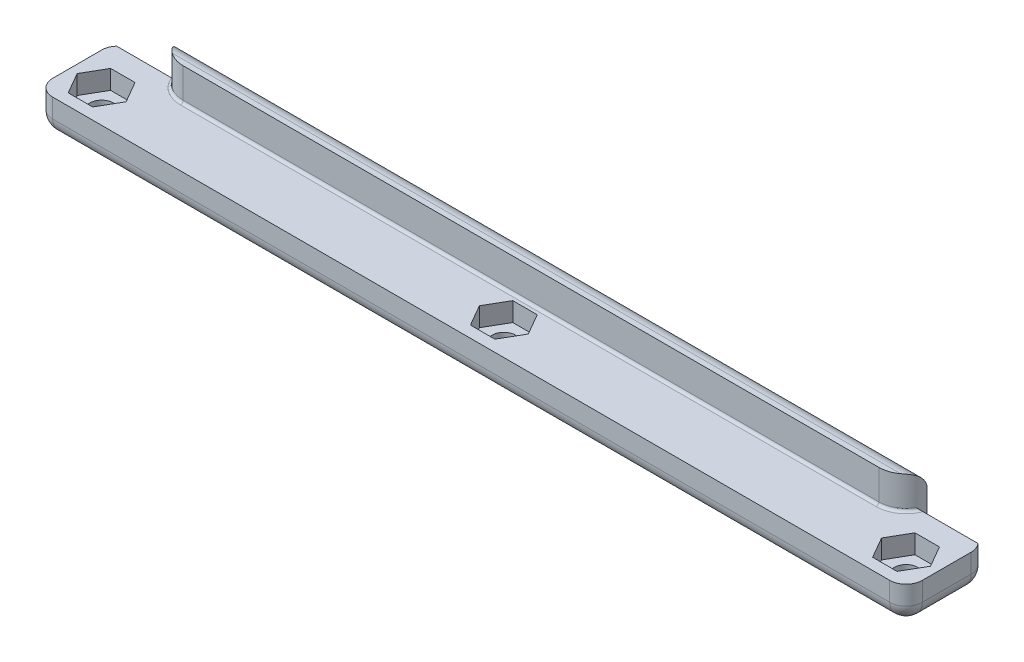
from build123d import *

# Parameters (mm, degrees)
SKETCH1_W                = 160
SKETCH1_H                = 12
BOSS_EXTRUDE1_DEPTH      = 3.5
SKETCH2_W                = 160
SKETCH2_H                = 12
SKETCH2_R                = 2.15
BOSS_EXTRUDE2_DEPTH      = 3
BOSS_EXTRUDE3_DEPTH      = 6
BOSS_EXTRUDE3_DEPTH_BACK = 6.5
CAVITY1_START            = 2.5
CAVITY1_DEPTH            = 7.5
CAVITY1_START_2          = -160
CAVITY1_2_DEPTH          = 160
FILLET2_R                = 3
FILLET3_R                = 3
FILLET4_R                = 0.5


with BuildPart() as part:
    # Sketch1 → Boss-Extrude1 (new body)
    with BuildSketch(Plane(origin=(0, 0, 0), x_dir=(1, 0, 0), z_dir=(0, 1, 0))):
        with Locations((-80, -6)):
            Rectangle(SKETCH1_W, SKETCH1_H)
        Polygon((-75.5, -6), (-77.75, -2.102885683), (-82.25, -2.102885683), (-84.5, -6), (-82.25, -9.897114317), (-77.75, -9.897114317), align=None, mode=Mode.SUBTRACT)
        Polygon((-149.5, -6), (-151.75, -2.102885683), (-156.25, -2.102885683), (-158.5, -6), (-156.25, -9.897114317), (-151.75, -9.897114317), align=None, mode=Mode.SUBTRACT)
        Polygon((-10.5, -6), (-8.25, -9.897114317), (-3.75, -9.897114317), (-1.5, -6), (-3.75, -2.102885683), (-8.25, -2.102885683), align=None, mode=Mode.SUBTRACT)
    extrude(amount=BOSS_EXTRUDE1_DEPTH)

    # Sketch2 → Boss-Extrude2 (add)
    with BuildSketch(Plane.XZ):
        with Locations((-80, 6)):
            Rectangle(SKETCH2_W, SKETCH2_H)
        with Locations(Location((-154, 6, 0), (0, 0, 270))):
            Circle(SKETCH2_R, mode=Mode.SUBTRACT)
        with Locations(Location((-80, 6, 0), (0, 0, 270))):
            Circle(SKETCH2_R, mode=Mode.SUBTRACT)
        with Locations(Location((-6, 6, 0), (0, 0, 270))):
            Circle(SKETCH2_R, mode=Mode.SUBTRACT)
    extrude(amount=BOSS_EXTRUDE2_DEPTH)

    # Sketch3 → Boss-Extrude3 (add, two sides: drawn at the far end of the back side and taken through both)
    with BuildSketch(Plane(origin=(0, 3.5, 0), x_dir=(1, 0, 0), z_dir=(0, 1, 0)).offset(-BOSS_EXTRUDE3_DEPTH_BACK)):
        Polygon((-80, -1), (0, -1), (0, 3), (-160, 3), (-160, -1), align=None)
    extrude(amount=BOSS_EXTRUDE3_DEPTH + BOSS_EXTRUDE3_DEPTH_BACK)

    # Cavity1: read off the stored shape, not the designer's step
    # Cavity1 outline → Cavity1 (cut)
    with BuildSketch(Plane(origin=(0, 0, 0), x_dir=(1, 0, 0), z_dir=(0, 1, 0)).offset(CAVITY1_START)):
        with BuildLine():
            ThreePointArc((-11.101020514, 3), (-12.83772234, 0.127016654), (-16, -1))
            Line((-16, -1), (0, -1))
            Line((0, -1), (0, 3))
            Line((0, 3), (-11.101020514, 3))
        make_face()
        with BuildLine():
            Line((-160, -1), (-144, -1))
            ThreePointArc((-144, -1), (-147.16227766, 0.127016654), (-148.898979486, 3))
            Line((-148.898979486, 3), (-160, 3))
            Line((-160, 3), (-160, -1))
        make_face()
    extrude(amount=CAVITY1_DEPTH, mode=Mode.SUBTRACT)

    # Cavity1 2 outline → Cavity1 2 (add)
    with BuildSketch(Plane.YZ.offset(CAVITY1_START_2)):
        Polygon((2.5, -3), (3.5, -2), (3.5, 1), (2.5, 1), align=None)
    extrude(amount=CAVITY1_2_DEPTH)

    # Fillet2
    fillet2_edges = [part.edges().sort_by_distance(p)[0] for p in [
        (-80, 9.5, -3),
    ]]
    fillet(fillet2_edges, radius=FILLET2_R)

    # Fillet3
    fillet3_edges = [part.edges().sort_by_distance(p)[0] for p in [
        (-80, -3, 12),
        (0, -3, 4.5),
        (-160, -3, 4.5),
        (-160, -0.25, -3),
        (-80, -3, -3),
        (0, -0.25, -3),
        (-160, 0.25, 12),
        (0, 0.25, 12),
    ]]
    fillet(fillet3_edges, radius=FILLET3_R)

    # Fillet4
    fillet4_edges = [part.edges().sort_by_distance(p)[0] for p in [
        (-80, 3.5, 1),
        (-146.738612787, 3.5, 0.183300132),
        (-13.261387213, 3.5, 0.183300132),
    ]]
    fillet(fillet4_edges, radius=FILLET4_R)


solid = part.part
